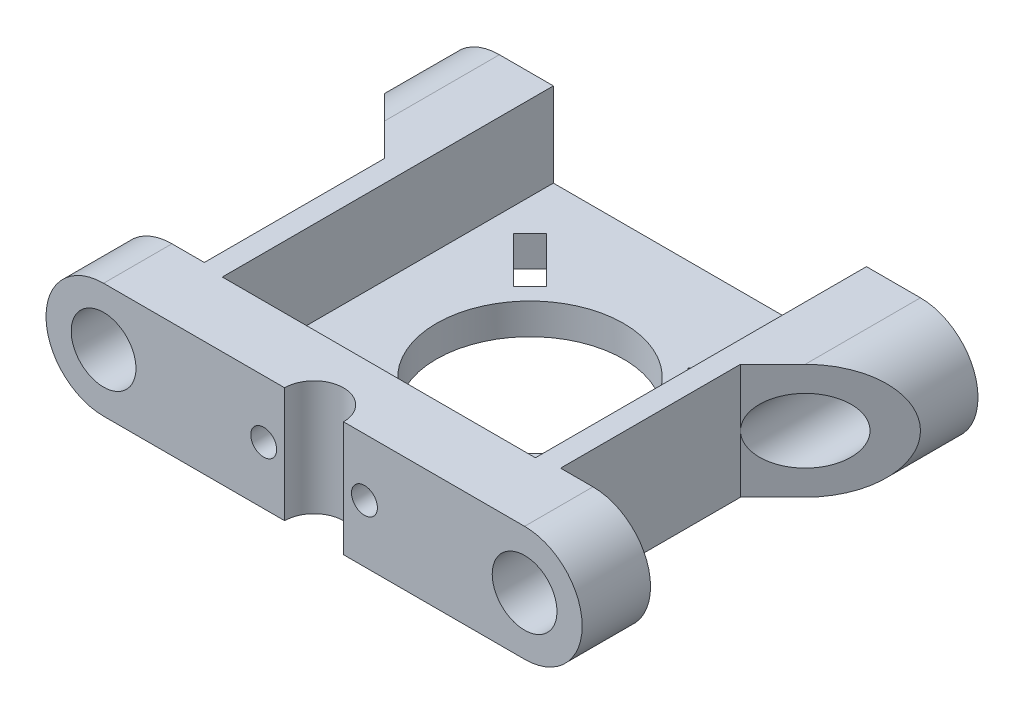
from build123d import *

# Parameters (mm, degrees)
SCHIZZO1_R        = 4.5
BASE_DEPTH        = 27.5
SCHIZZO3_R        = 13
HOLES_DEPTH       = 49.987881154
SCHIZZO5_W        = 43.5
SCHIZZO5_H        = 46
FLANGE_DEPTH      = 11.7
SCREW_HOLES_REACH = 68.907
SCHIZZO6_R        = 1.8
NUT_START         = -2.4
SCHIZZO7_R        = 1.8
NUT_HOLES_DEPTH   = 2.4


with BuildPart() as part:
    # Schizzo1 → Base (new, symmetric)
    with BuildSketch(Plane.XY):
        with BuildLine():
            Line((-29.25, -8), (29.25, -8))
            ThreePointArc((29.25, -8), (37.25, 0), (29.25, 8))
            Line((29.25, 8), (-29.25, 8))
            ThreePointArc((-29.25, 8), (-37.25, 0), (-29.25, -8))
        make_face()
        with Locations((-29.25, 0)):
            Circle(SCHIZZO1_R, mode=Mode.SUBTRACT)
        with Locations((29.25, 0)):
            Circle(SCHIZZO1_R, mode=Mode.SUBTRACT)
    extrude(amount=BASE_DEPTH, both=True)

    # Schizzo3 → Holes (cut, through all)
    with BuildSketch(Plane(origin=(0, 8, 0), x_dir=(1, 0, 0), z_dir=(0, 1, 0))):
        Polygon((9.828784258, 14.591525958), (12.091525958, 12.328784258), (18.455486989, 18.692745289), (16.192745289, 20.955486989), align=None)
        with BuildLine():
            Line((-4.09, -27.5), (4.09, -27.5))
            ThreePointArc((4.09, -27.5), (0, -23.41), (-4.09, -27.5))
        make_face()
        Polygon((37.25, -18), (37.25, 19.5), (24.75, 7), (24.75, -18), align=None)
        Polygon((-24.75, 7), (-37.25, 19.5), (-37.25, -18), (-24.75, -18), align=None)
        Polygon((-12.091525958, 12.328784258), (-9.828784258, 14.591525958), (-16.192745289, 20.955486989), (-18.455486989, 18.692745289), align=None)
        Polygon((12.091525958, -7.328784258), (9.828784258, -9.591525958), (16.192745289, -15.955486989), (18.455486989, -13.692745289), align=None)
        Polygon((-9.828784258, -9.591525958), (-12.091525958, -7.328784258), (-18.455486989, -13.692745289), (-16.192745289, -15.955486989), align=None)
        with Locations((0, 2.5)):
            Circle(SCHIZZO3_R)
    extrude(amount=-HOLES_DEPTH, mode=Mode.SUBTRACT)

    # Schizzo5 → Flange (cut)
    with BuildSketch(Plane(origin=(0, 8, 0), x_dir=(1, 0, 0), z_dir=(0, 1, 0))):
        with Locations((0, 4.5)):
            Rectangle(SCHIZZO5_W, SCHIZZO5_H)
    extrude(amount=-FLANGE_DEPTH, mode=Mode.SUBTRACT)

    # Schizzo6 → Screw holes (cut, up to next)
    with BuildSketch(Plane.XY.offset(27.5), mode=Mode.PRIVATE) as screw_holes_sk1:
        with Locations((7, 0)):
            Circle(SCHIZZO6_R)
    screw_holes_tool1 = extrude(screw_holes_sk1.sketch, amount=-SCREW_HOLES_REACH, mode=Mode.PRIVATE) & part.part
    # Schizzo6 → Screw holes (cut, up to next)
    with BuildSketch(Plane.XY.offset(27.5), mode=Mode.PRIVATE) as screw_holes_sk2:
        with Locations((-7, 0)):
            Circle(SCHIZZO6_R)
    screw_holes_tool2 = extrude(screw_holes_sk2.sketch, amount=-SCREW_HOLES_REACH, mode=Mode.PRIVATE) & part.part
    add(screw_holes_tool1.solids().sort_by_distance((7, 0, 27.5))[0], mode=Mode.SUBTRACT)
    add(screw_holes_tool2.solids().sort_by_distance((-7, 0, 27.5))[0], mode=Mode.SUBTRACT)

    # Schizzo7 → Nut holes (cut)
    # profile 1 of 2: a face of its own
    with BuildSketch(Plane(origin=(0, 0, 18.5), x_dir=(-1, 0, 0), z_dir=(0, 0, -1)).offset(NUT_START)):
        Polygon((-3.6, 0), (-5.3, 2.944486373), (-8.7, 2.944486373), (-10.4, 0), (-8.7, -2.944486373), (-5.3, -2.944486373), align=None)
    # profile 2 of 2: a face of its own
    with BuildSketch(Plane(origin=(0, 0, 18.5), x_dir=(-1, 0, 0), z_dir=(0, 0, -1)).offset(NUT_START)):
        Polygon((10.4, 0), (8.7, 2.944486373), (5.3, 2.944486373), (3.6, 0), (5.3, -2.944486373), (8.7, -2.944486373), align=None)
        with Locations((7, 0)):
            Circle(SCHIZZO7_R, mode=Mode.SUBTRACT)
    extrude(amount=NUT_HOLES_DEPTH, mode=Mode.SUBTRACT)


solid = part.part
